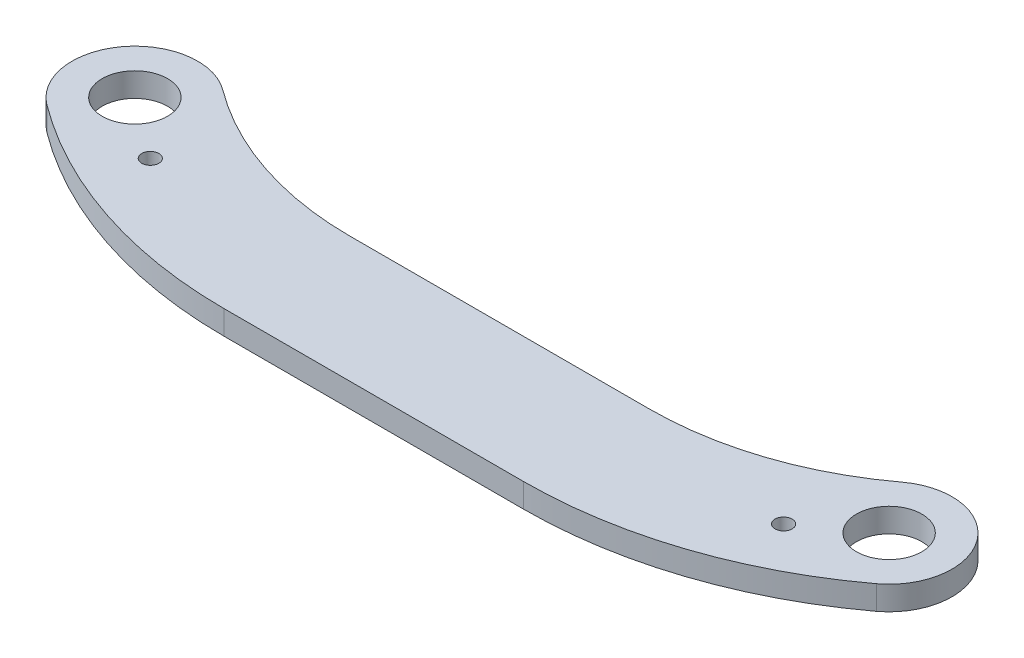
from build123d import *

# Parameters (mm, degrees)
ESBO_O1_R          = 13
ESBO_O1_R_2        = 3.4
FLANGE_BASE1_DEPTH = 9.53


# Sheet-metal steps are written as plain solids
with BuildPart() as part:
    # Esboço1 → Flange-base1 (new body)
    with BuildSketch(Plane(origin=(0, 0, 0), x_dir=(1, 0, 0), z_dir=(0, 1, 0))):
        with BuildLine():
            Line((-59.5, -5), (59.5, -5))
            ThreePointArc((59.5, -5), (99.305049758, 1.425599896), (135.066417315, 20.049641099))
            ThreePointArc((135.066417315, 20.049641099), (170.049641099, 14.933582685), (164.933582685, -20.049641099))
            ThreePointArc((164.933582685, -20.049641099), (115.037752802, -46.034720952), (59.5, -55))
            Line((59.5, -55), (-59.5, -55))
            ThreePointArc((-59.5, -55), (-115.037752802, -46.034720952), (-164.933582685, -20.049641099))
            ThreePointArc((-164.933582685, -20.049641099), (-170.049641099, 14.933582685), (-135.066417315, 20.049641099))
            ThreePointArc((-135.066417315, 20.049641099), (-99.305049758, 1.425599896), (-59.5, -5))
        make_face()
        with Locations(Location((-150, 0, 0), (0, 0, 270))):
            Circle(ESBO_O1_R, mode=Mode.SUBTRACT)
        with Locations(Location((150, 0, 0), (0, 0, 270))):
            Circle(ESBO_O1_R, mode=Mode.SUBTRACT)
        with Locations(Location((-125.94, -17.92, 0), (0, 0, 270))):
            Circle(ESBO_O1_R_2, mode=Mode.SUBTRACT)
        with Locations(Location((125.94, -17.92, 0), (0, 0, 270))):
            Circle(ESBO_O1_R_2, mode=Mode.SUBTRACT)
    extrude(amount=-FLANGE_BASE1_DEPTH)


solid = part.part
